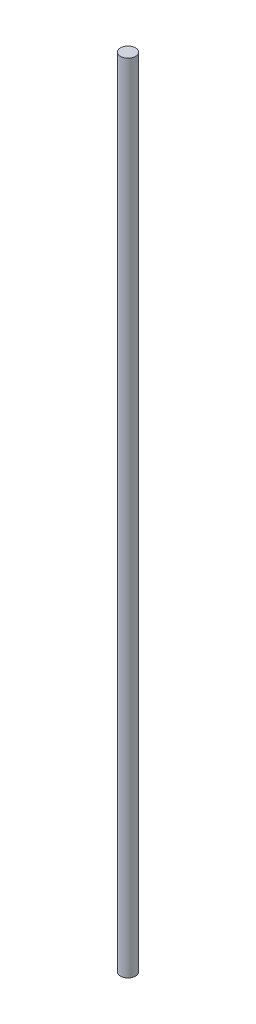
from build123d import *

# Parameters (mm, degrees)
SKETCH1_R           = 4.7625
BOSS_EXTRUDE1_DEPTH = 254


with BuildPart() as part:
    # Sketch1 → Boss-Extrude1 (new, symmetric)
    with BuildSketch(Plane(origin=(0, 0, 0), x_dir=(1, 0, 0), z_dir=(0, 1, 0))):
        Circle(SKETCH1_R)
    extrude(amount=BOSS_EXTRUDE1_DEPTH, both=True)


solid = part.part
